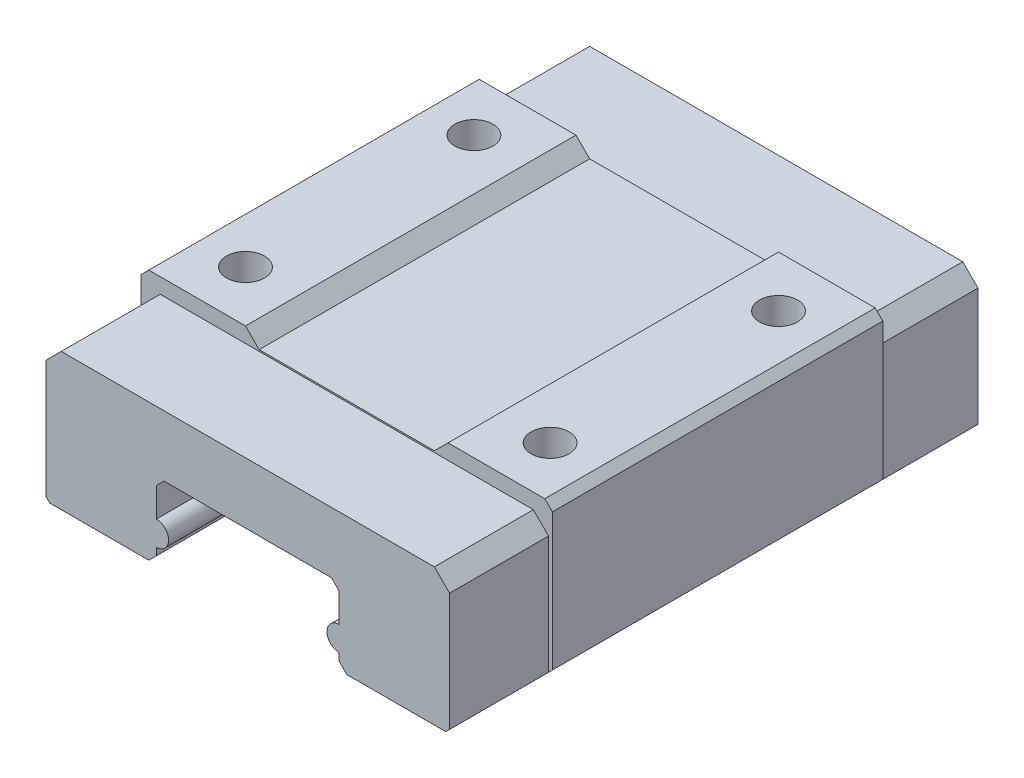
from build123d import *

# Parameters (mm, degrees)
MAINBLOCKSKETCH_W              = 26.5
MAINBLOCKSKETCH_H              = 34.7
MAINBLOCK_DEPTH                = 9
FACEDSURFACESKETCH_W           = 27
FACEDSURFACESKETCH_H           = 21.7
FACEDSURFACE_DEPTH             = 10
M3X0_5_TAPPED_HOLE1_D          = 2.5
M3X0_5_TAPPED_HOLE1_DEPTH      = 8.5
M3X0_5_TAPPED_HOLE1_TIP        = 0.751075774
RAIL_SLOT_DEPTH                = 25.151035175
RAIL_SLOT_DEPTH_BACK           = 25.151035175
INTERNAL_DIP_SKETCH_W          = 13.5
INTERNAL_DIP_SKETCH_H          = 21.7
INTERNAL_DIP_DEPTH             = 0.9
INTERNAL_CHAMFER_SIZE          = 0.5
COSMETIC_CHAMFERS_SIZE         = 1
SMALLER_COSMETIC_CHAMFERS_SIZE = 0.5


with BuildPart() as part:
    # MainBlockSketch → MainBlock (new body)
    with BuildSketch(Plane(origin=(0, 0, 0), x_dir=(1, 0, 0), z_dir=(0, 1, 0))):
        Rectangle(MAINBLOCKSKETCH_W, MAINBLOCKSKETCH_H)
    extrude(amount=MAINBLOCK_DEPTH)

    # FacedSurfaceSketch → FacedSurface (add)
    with BuildSketch(Plane(origin=(0, 0, 0), x_dir=(1, 0, 0), z_dir=(0, 1, 0))):
        Rectangle(FACEDSURFACESKETCH_W, FACEDSURFACESKETCH_H)
    extrude(amount=FACEDSURFACE_DEPTH)

    # M3x0.5 Tapped Hole1
    with Locations(Plane(origin=(0, 10, 0), x_dir=(1, 0, 0), z_dir=(0, 1, 0))):
        with Locations((-10, 7.5), (10, 7.5), (10, -7.5), (-10, -7.5)):
            Hole(M3X0_5_TAPPED_HOLE1_D / 2, depth=M3X0_5_TAPPED_HOLE1_DEPTH)
            with Locations((0, 0, -(M3X0_5_TAPPED_HOLE1_DEPTH + M3X0_5_TAPPED_HOLE1_TIP / 2))):  # 118° drill point
                Cone(0, M3X0_5_TAPPED_HOLE1_D / 2, M3X0_5_TAPPED_HOLE1_TIP, mode=Mode.SUBTRACT)

    # RailSlotSketch → Rail Slot (cut, two sides: drawn at the far end of the back side and taken through both)
    with BuildSketch(Plane.XY.offset(-RAIL_SLOT_DEPTH_BACK)):
        with BuildLine():
            Line((-6, 2.59), (-6, 5))
            Line((-6, 5), (6, 5))
            Line((6, 5), (6, 2.59))
            ThreePointArc((6, 2.59), (5.2, 1.79), (6, 0.99))
            Line((6, 0.99), (6, 0))
            Line((6, 0), (-6, 0))
            Line((-6, 0), (-6, 0.99))
            ThreePointArc((-6, 0.99), (-5.2, 1.79), (-6, 2.59))
        make_face()
    extrude(amount=RAIL_SLOT_DEPTH + RAIL_SLOT_DEPTH_BACK, mode=Mode.SUBTRACT)

    # Internal Dip Sketch → Internal Dip (cut)
    with BuildSketch(Plane(origin=(0, 10, 0), x_dir=(1, 0, 0), z_dir=(0, 1, 0))):
        Rectangle(INTERNAL_DIP_SKETCH_W, INTERNAL_DIP_SKETCH_H)
    extrude(amount=-INTERNAL_DIP_DEPTH, mode=Mode.SUBTRACT)

    # Internal Chamfer
    internal_chamfer_edges = [part.edges().sort_by_distance(p)[0] for p in [
        (6, 5, 0),
        (-6, 5, 0),
    ]]
    chamfer(internal_chamfer_edges, length=INTERNAL_CHAMFER_SIZE)

    # Cosmetic Chamfers
    # the kernel refuses this chamfer: 1 mm, written as the material it adds along each edge
    with BuildSketch(Plane(origin=(-6.75, 9.1, 10.85), x_dir=(0.9996219169112968, -0.027495876610585623, 0), z_dir=(0, 0, -1))) as cosmetic_chamfers_piece_1_section:
        Polygon((COSMETIC_CHAMFERS_SIZE * 0.999621916911, -COSMETIC_CHAMFERS_SIZE * 0.0274958766106), (-COSMETIC_CHAMFERS_SIZE * 0.0274958766106, -COSMETIC_CHAMFERS_SIZE * 0.999621916911), (0, 0), align=None)
    cosmetic_chamfers_piece_1 = extrude(amount=21.7, mode=Mode.PRIVATE)
    cosmetic_chamfers_piece_1 = split(cosmetic_chamfers_piece_1, bisect_by=Plane(origin=(-6.414099253, 10, 0), z_dir=(0, -1, 0)), keep=Keep.TOP, mode=Mode.PRIVATE)
    add(cosmetic_chamfers_piece_1)
    with BuildSketch(Plane(origin=(6.75, 9.1, -10.85), x_dir=(0.02749587661058651, 0.9996219169112968, 0), z_dir=(0, 0, 1))) as cosmetic_chamfers_piece_2_section:
        Polygon((COSMETIC_CHAMFERS_SIZE * 0.999621916911, COSMETIC_CHAMFERS_SIZE * 0.0274958766106), (-COSMETIC_CHAMFERS_SIZE * 0.0274958766106, COSMETIC_CHAMFERS_SIZE * 0.999621916911), (0, 0), align=None)
    cosmetic_chamfers_piece_2 = extrude(amount=21.7, mode=Mode.PRIVATE)
    cosmetic_chamfers_piece_2 = split(cosmetic_chamfers_piece_2, bisect_by=Plane(origin=(6.414099253, 10, 0), z_dir=(0, -1, 0)), keep=Keep.TOP, mode=Mode.PRIVATE)
    add(cosmetic_chamfers_piece_2)
    # the kernel refuses this chamfer: 1 mm, written as the material it takes off along each edge
    with BuildSketch(Plane(origin=(13.25, 9, 19.921682988), x_dir=(0.027495876610585623, -0.9996219169112968, 0), z_dir=(0, 0, -1))) as cosmetic_chamfers_2_piece_1:
        Polygon((COSMETIC_CHAMFERS_SIZE * 0.999621916911, COSMETIC_CHAMFERS_SIZE * 0.0274958766106), (-COSMETIC_CHAMFERS_SIZE * 0.0274958766106, COSMETIC_CHAMFERS_SIZE * 0.999621916911), (0, 0), align=None)
    extrude(amount=9.071682988, mode=Mode.SUBTRACT)
    with BuildSketch(Plane(origin=(-13.25, 9, 10.85), x_dir=(0.9996219169112968, 0.027495876610585647, 0), z_dir=(0, 0, 1)), Plane(origin=(-13.25, 9, -19.921682988), x_dir=(0.9996219169112968, 0.027495876610585647, 0), z_dir=(0, 0, 1)), Plane(origin=(13.25, 9, -10.85), x_dir=(-0.9996219169112968, 0.027495876610585647, 0), z_dir=(0, 0, -1))) as cosmetic_chamfers_2_piece_2:
        Polygon((COSMETIC_CHAMFERS_SIZE * 0.999621916911, -COSMETIC_CHAMFERS_SIZE * 0.0274958766106), (-COSMETIC_CHAMFERS_SIZE * 0.0274958766106, -COSMETIC_CHAMFERS_SIZE * 0.999621916911), (0, 0), align=None)
    extrude(amount=9.071682988, mode=Mode.SUBTRACT)

    # Smaller Cosmetic Chamfers
    smaller_cosmetic_chamfers_edges = [part.edges().sort_by_distance(p)[0] for p in [
        (13.5, 10, 0),
        (-13.5, 10, 0),
        (-13.5, 0, 0),
        (13.5, 0, 0),
        (6, 0, 0),
        (-6, 0, 0),
    ]]
    chamfer(smaller_cosmetic_chamfers_edges, length=SMALLER_COSMETIC_CHAMFERS_SIZE)


solid = part.part
